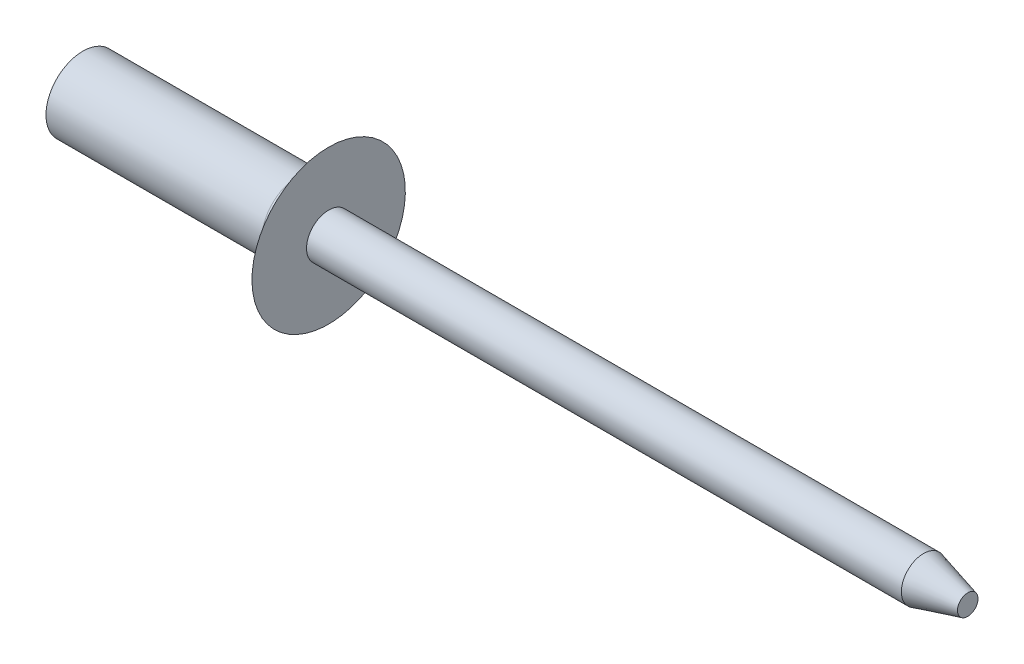
from build123d import *

# Parameters (mm, degrees)
FILLET1_R      = 0.5
CHAMFER1_SIZE  = 1.8
CHAMFER1_SIZE2 = 0.482308546


with BuildPart() as part:
    # Sketch1 → Base-Revolve (revolve)
    with BuildSketch(Plane(origin=(-20.795345595, 23.915345595, 0), x_dir=(0, -1, 0), z_dir=(0, 0, 1))):
        Polygon((23.915345595, 20.795345595), (25.415345595, 20.795345595), (25.415345595, 29.860038159), (27.035345595, 30.795345595), (24.815345595, 30.795345595), (24.815345595, 56.795345595), (23.915345595, 56.795345595), align=None)
    revolve(axis=Axis((30.374202237, 0, 0), (-1, 0, 0)))

    # Fillet1
    fillet1_edges = [part.edges().sort_by_distance(p)[0] for p in [
        (9.064692564, 1.5, 0),
    ]]
    fillet(fillet1_edges, radius=FILLET1_R)

    # Chamfer1
    chamfer1_edges = [part.edges().sort_by_distance(p)[0] for p in [
        (36, 0.9, 0),
    ]]
    chamfer1_side = [part.faces().sort_by_distance(p)[0] for p in [
        (23, 0.9, 0),
    ]]
    chamfer(chamfer1_edges, length=CHAMFER1_SIZE, length2=CHAMFER1_SIZE2, reference=chamfer1_side[0])


solid = part.part
